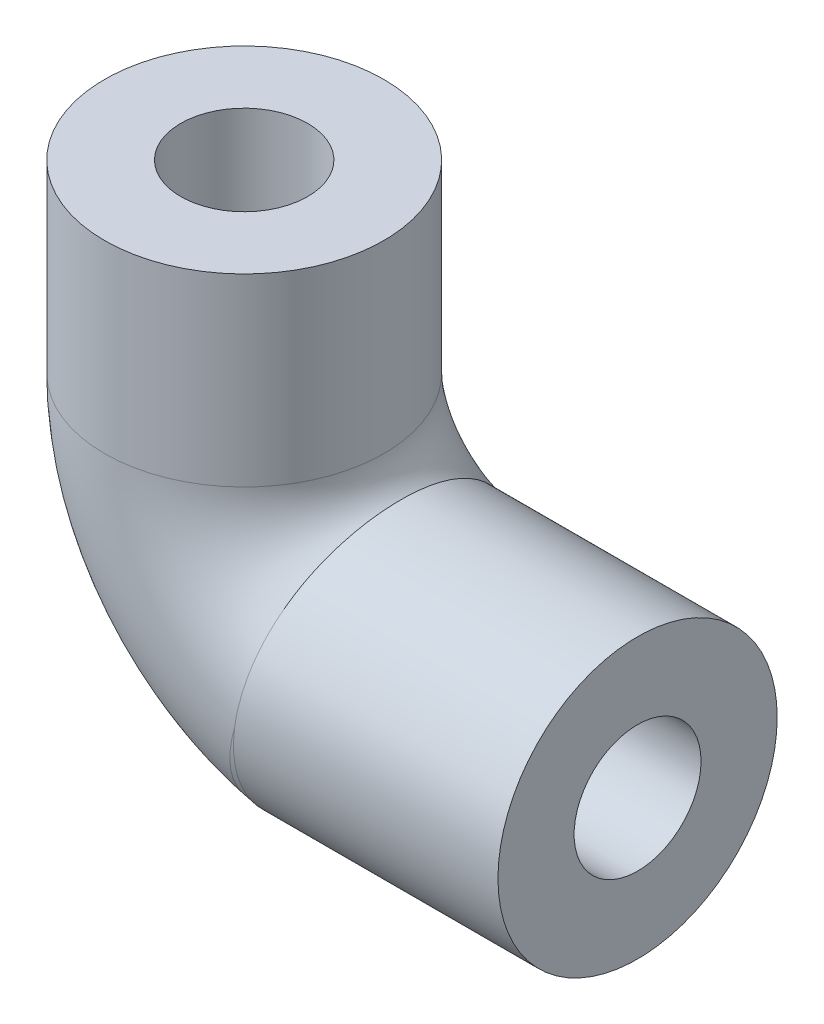
from build123d import *

# Parameters (mm, degrees)
SKETCH2_R   = 13.97
SKETCH2_R_2 = 6.35


with BuildPart() as part:
    # Sweep1: sweep along a path in Sketch1
    with BuildLine(Plane.XY) as sweep1_path:
        Line((-18.606445461, 18.463318957), (-18.606445461, 0))
        ThreePointArc((-18.606445461, 0), (-14.980614101, -10.760479083), (-5.581933638, -17.132242474))
        Line((-5.581933638, -17.132242474), (20.753343014, -17.132242474))
    # Sketch2 → Sweep1 (sweep)
    with BuildSketch(Plane(origin=(20.753343014, -17.132242474, 0), x_dir=(0, 0, -1), z_dir=(1, 0, 0))):
        Circle(SKETCH2_R)
        Circle(SKETCH2_R_2, mode=Mode.SUBTRACT)
    sweep(path=sweep1_path.line, transition=Transition.RIGHT)


solid = part.part
